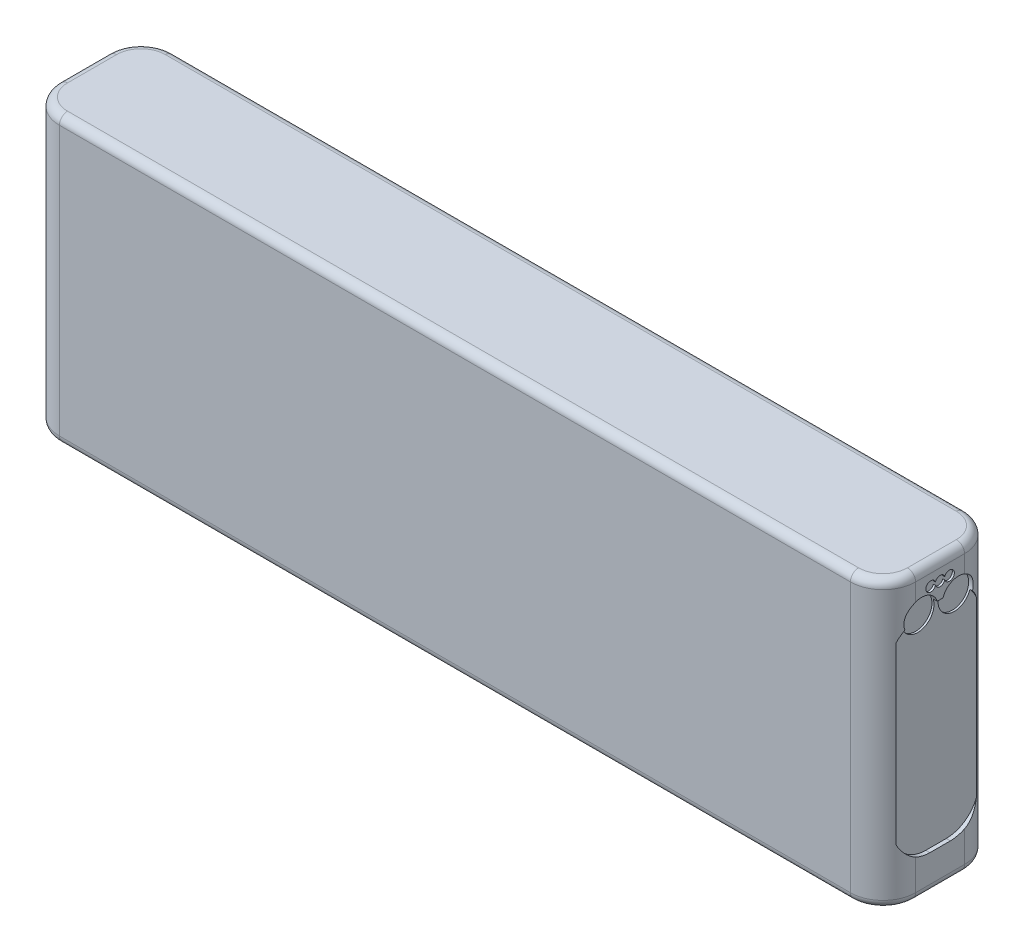
from build123d import *

# Parameters (mm, degrees)
SKETCH1_W                           = 105
SKETCH1_H                           = 35
BOSS_EXTRUDE1_DEPTH                 = 14
CUT_EXTRUDE1_DEPTH                  = 0.5
CUT_EXTRUDE2_START                  = -0.5
CUT_EXTRUDE2_DEPTH                  = 0.5
FILLET1_R                           = 4
FILLET2_R                           = 1
ESQUISSE1_R                         = 2
ENL_V_MAT_EXTRU_1_DEPTH             = 0.25
ENL_V_MAT_EXTRU_1_DIRECTION_2_REACH = 109.012
ENL_V_MAT_EXTRU_4_DEPTH             = 0.25


with BuildPart() as part:
    # Sketch1 → Boss-Extrude1 (new body)
    with BuildSketch(Plane(origin=(0, 0, -15), x_dir=(-1, 0, 0), z_dir=(0, 0, -1))):
        Rectangle(SKETCH1_W, SKETCH1_H)
    extrude(amount=-BOSS_EXTRUDE1_DEPTH)

    # Sketch2 → Cut-Extrude1 (cut)
    with BuildSketch(Plane(origin=(52.5, 0, 0), x_dir=(0, 0, -1), z_dir=(1, 0, 0))):
        with BuildLine():
            Line((2.75, 9.125), (2.75, -9.125))
            ThreePointArc((2.75, -9.125), (3.921572875, -11.953427125), (6.75, -13.125))
            Line((6.75, -13.125), (9.25, -13.125))
            ThreePointArc((9.25, -13.125), (12.078427125, -11.953427125), (13.25, -9.125))
            Line((13.25, -9.125), (13.25, 9.125))
            ThreePointArc((13.25, 9.125), (12.078427125, 11.953427125), (9.25, 13.125))
            Line((9.25, 13.125), (6.75, 13.125))
            ThreePointArc((6.75, 13.125), (3.921572875, 11.953427125), (2.75, 9.125))
        make_face()
    extrude(amount=-CUT_EXTRUDE1_DEPTH, mode=Mode.SUBTRACT)

    # Sketch3 → Cut-Extrude2 (cut)
    with BuildSketch(Plane.ZY.offset(52.5).offset(CUT_EXTRUDE2_START)):
        with BuildLine():
            Line((-6.75, 13.125), (-9.25, 13.125))
            ThreePointArc((-9.25, 13.125), (-12.078427125, 11.953427125), (-13.25, 9.125))
            Line((-13.25, 9.125), (-13.25, -9.125))
            ThreePointArc((-13.25, -9.125), (-12.078427125, -11.953427125), (-9.25, -13.125))
            Line((-9.25, -13.125), (-6.75, -13.125))
            ThreePointArc((-6.75, -13.125), (-3.921572875, -11.953427125), (-2.75, -9.125))
            Line((-2.75, -9.125), (-2.75, 9.125))
            ThreePointArc((-2.75, 9.125), (-3.921572875, 11.953427125), (-6.75, 13.125))
        make_face()
    extrude(amount=CUT_EXTRUDE2_DEPTH, mode=Mode.SUBTRACT)

    # Fillet1
    # the kernel refuses this fillet: 4 mm, written as the material it takes off along each edge
    with BuildSketch(Plane(origin=(-52.5, -27.5, -15), x_dir=(0, 0, 1), z_dir=(0, 1, 0)), Plane(origin=(52.5, 27.5, -15), x_dir=(0, 0, 1), z_dir=(0, -1, 0))) as fillet1_piece_1:
        with BuildLine():
            CenterArc((FILLET1_R, FILLET1_R), FILLET1_R, 180, 90)
            Line((0, FILLET1_R), (0, 0))
            Line((0, 0), (FILLET1_R, 0))
        make_face()
    extrude(amount=55, mode=Mode.SUBTRACT)
    with BuildSketch(Plane(origin=(-52.5, -27.5, -1), x_dir=(0, 0, -1), z_dir=(0, 1, 0)), Plane(origin=(52.5, 27.5, -1), x_dir=(0, 0, -1), z_dir=(0, -1, 0))) as fillet1_piece_2:
        with BuildLine():
            CenterArc((FILLET1_R, -FILLET1_R), FILLET1_R, 90, 90)
            Line((0, -FILLET1_R), (0, 0))
            Line((0, 0), (FILLET1_R, 0))
        make_face()
    extrude(amount=55, mode=Mode.SUBTRACT)

    # Fillet2
    fillet2_edges = [part.edges().sort_by_distance(p)[0] for p in [
        (0, -17.5, -15),
        (0, 17.5, -15),
        (-52.5, 17.5, -8),
        (0, 17.5, -1),
        (52.5, 17.5, -8),
        (51.328427125, 17.5, -2.171572875),
        (51.328427125, 17.5, -13.828427125),
        (-51.328427125, 17.5, -2.171572875),
        (-51.328427125, 17.5, -13.828427125),
        (-52.5, -17.5, -8),
        (52.5, -17.5, -8),
        (0, -17.5, -1),
        (51.328427125, -17.5, -2.171572875),
        (51.328427125, -17.5, -13.828427125),
        (-51.328427125, -17.5, -2.171572875),
        (-51.328427125, -17.5, -13.828427125),
    ]]
    fillet(fillet2_edges, radius=FILLET2_R)

    # Esquisse1 → Enlèv. mat.-Extru.1 (cut)
    with BuildSketch(Plane(origin=(52, 0, 0), x_dir=(0, 0, -1), z_dir=(1, 0, 0))):
        with Locations(Location((5.75, 12.5, 0), (0, 0, 198.094122224))):
            Circle(ESQUISSE1_R)
        with Locations(Location((10.25, 12.5, 0), (0, 0, 161.790043136))):
            Circle(ESQUISSE1_R)
    extrude(amount=-ENL_V_MAT_EXTRU_1_DEPTH, mode=Mode.SUBTRACT)

    # Esquisse1 → Enlèv. mat.-Extru.1 direction 2 (cut, up to next)
    with BuildSketch(Plane(origin=(52, 0, 0), x_dir=(0, 0, -1), z_dir=(1, 0, 0)), mode=Mode.PRIVATE) as enl_v_mat_extru_1_direction_2_sk1:
        with Locations(Location((5.75, 12.5, 0), (0, 0, 198.094122224))):
            Circle(ESQUISSE1_R)
    enl_v_mat_extru_1_direction_2_tool1 = extrude(enl_v_mat_extru_1_direction_2_sk1.sketch, amount=ENL_V_MAT_EXTRU_1_DIRECTION_2_REACH, mode=Mode.PRIVATE) & part.part
    # Esquisse1 → Enlèv. mat.-Extru.1 direction 2 (cut, up to next)
    with BuildSketch(Plane(origin=(52, 0, 0), x_dir=(0, 0, -1), z_dir=(1, 0, 0)), mode=Mode.PRIVATE) as enl_v_mat_extru_1_direction_2_sk2:
        with Locations(Location((10.25, 12.5, 0), (0, 0, 161.790043136))):
            Circle(ESQUISSE1_R)
    enl_v_mat_extru_1_direction_2_tool2 = extrude(enl_v_mat_extru_1_direction_2_sk2.sketch, amount=ENL_V_MAT_EXTRU_1_DIRECTION_2_REACH, mode=Mode.PRIVATE) & part.part
    add(enl_v_mat_extru_1_direction_2_tool1.solids().sort_by_distance((52, 12.5, -5.75))[0], mode=Mode.SUBTRACT)
    add(enl_v_mat_extru_1_direction_2_tool2.solids().sort_by_distance((52, 12.5, -10.25))[0], mode=Mode.SUBTRACT)

    # Esquisse2 → Enlèv. mat.-Extru.4 (cut)
    with BuildSketch(Plane(origin=(52.5, 0, 0), x_dir=(0, 0, -1), z_dir=(1, 0, 0))):
        with BuildLine():
            ThreePointArc((7.425, 14.928608635), (8, 14.5), (8.575, 14.928608635))
            ThreePointArc((8.575, 14.928608635), (9.75, 15.1), (8.575, 15.271391365))
            ThreePointArc((8.575, 15.271391365), (8, 15.7), (7.425, 15.271391365))
            ThreePointArc((7.425, 15.271391365), (6.25, 15.1), (7.425, 14.928608635))
        make_face()
    extrude(amount=-ENL_V_MAT_EXTRU_4_DEPTH, mode=Mode.SUBTRACT)


solid = part.part
